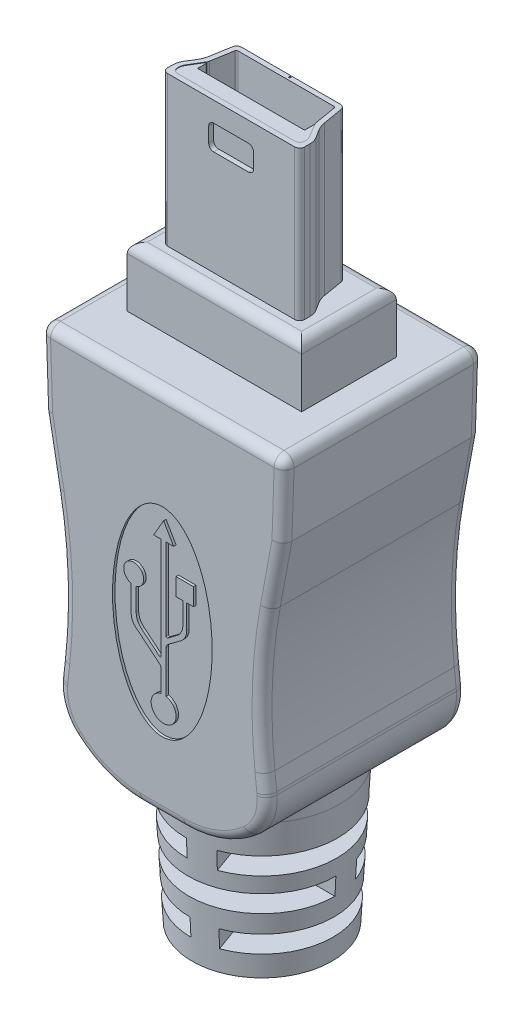
from build123d import *

# Parameters (mm, degrees)
BOSS_EXTRUDE1_DEPTH           = 10.16
FILLET1_R                     = 0.508
SKETCH2_RX                    = 5.08
SKETCH2_RY                    = 2.54
CUT_EXTRUDE1_DEPTH            = 0.127
BOSS_EXTRUDE2_DEPTH           = 0.127
SKETCH5_R                     = 3.937
BOSS_EXTRUDE3_DEPTH           = 7.112
BOSS_EXTRUDE3_TAPER           = 3
BOSS_EXTRUDE3_OTHER_WAY_DEPTH = 1.143
SKETCH6_W                     = 3.70295444
SKETCH6_H                     = 0.9144
SKETCH6_W_2                   = 4.181326544
SKETCH6_W_3                   = 3.560751893
SKETCH6_W_4                   = 3.266263681
CUT_REVOLVE1_ANGLE            = 160
SKETCH7_W                     = 3.335369985
SKETCH7_H                     = 0.9144
SKETCH7_W_2                   = 3.520668317
CUT_REVOLVE2_ANGLE            = 160
SKETCH8_W                     = 8.89
SKETCH8_H                     = 4.826
BOSS_EXTRUDE4_DEPTH           = 3.048
FILLET2_R                     = 0.508
BOSS_EXTRUDE5_DEPTH           = 7.62
CUT_EXTRUDE2_DEPTH            = 0.0254
CUT_EXTRUDE3_DEPTH            = 7.5946
FILLET3_R                     = 0.254
FILLET4_R                     = 0.0508
CUT_EXTRUDE4_DEPTH            = 0.254
SKETCH13_W                    = 0.2032
SKETCH13_H                    = 6.076805898
CUT_EXTRUDE5_DEPTH            = 0.127
FILLET5_R                     = 0.1016
CUT_EXTRUDE6_DEPTH            = 0.127


# Some blends are built 0.0001 mm under size
with BuildPart() as part:
    # Sketch1 → Boss-Extrude1 (new body)
    with BuildSketch(Plane.XY):
        with BuildLine():
            Line((-1.103751948, 0), (1.103751948, 0))
            ThreePointArc((1.103751948, 0), (2.928013381, 0.338853491), (4.508905778, 1.310208574))
            ThreePointArc((4.508905778, 1.310208574), (5.167779206, 2.25960855), (5.337834863, 3.402655173))
            ThreePointArc((5.337834863, 3.402655173), (5.331898585, 3.469616815), (5.325076735, 3.536494039))
            Line((5.325076735, 3.536494039), (5.228731209, 4.422872879))
            ThreePointArc((5.228731209, 4.422872879), (5.09778186, 8.117825142), (5.504637644, 11.792643279))
            Line((5.504637644, 11.792643279), (6.096, 14.986))
            Line((6.096, 14.986), (6.223, 18.796))
            Line((6.223, 18.796), (-6.223, 18.796))
            Line((-6.223, 18.796), (-6.096, 14.986))
            Line((-6.096, 14.986), (-5.504637644, 11.792643279))
            ThreePointArc((-5.504637644, 11.792643279), (-5.09778186, 8.117825142), (-5.228731209, 4.422872879))
            Line((-5.228731209, 4.422872879), (-5.325076735, 3.536494039))
            ThreePointArc((-5.325076735, 3.536494039), (-5.331898585, 3.469616815), (-5.337834863, 3.402655173))
            ThreePointArc((-5.337834863, 3.402655173), (-5.167779206, 2.25960855), (-4.508905778, 1.310208574))
            ThreePointArc((-4.508905778, 1.310208574), (-2.928013381, 0.338853491), (-1.103751948, 0))
        make_face()
    extrude(amount=BOSS_EXTRUDE1_DEPTH)

    # Fillet1
    fillet1_edges = [part.edges().sort_by_distance(p)[0] for p in [
        (0, 18.796, 10.16),
        (-6.1595, 16.891, 10.16),
        (5.09778186, 8.117825142, 0),
        (5.276903972, 3.979683459, 0),
        (5.331898585, 3.469616815, 0),
        (5.167779206, 2.25960855, 0),
        (2.928013381, 0.338853491, 0),
        (-5.800318822, 13.389321639, 10.16),
        (0, 0, 0),
        (-2.928013381, 0.338853491, 0),
        (-5.167779206, 2.25960855, 0),
        (-5.331898585, 3.469616815, 0),
        (-5.276903972, 3.979683459, 0),
        (-5.09778186, 8.117825142, 0),
        (-5.800318822, 13.389321639, 0),
        (-6.1595, 16.891, 0),
        (-5.09778186, 8.117825142, 10.16),
        (0, 18.796, 0),
        (6.1595, 16.891, 0),
        (5.800318822, 13.389321639, 0),
        (-5.276903972, 3.979683459, 10.16),
        (-5.331898585, 3.469616815, 10.16),
        (-6.223, 18.796, 5.08),
        (6.223, 18.796, 5.08),
        (-5.167779206, 2.25960855, 10.16),
        (-2.928013381, 0.338853491, 10.16),
        (0, 0, 10.16),
        (2.928013381, 0.338853491, 10.16),
        (5.800318822, 13.389321639, 10.16),
        (5.167779206, 2.25960855, 10.16),
        (5.331898585, 3.469616815, 10.16),
        (5.276903972, 3.979683459, 10.16),
        (5.09778186, 8.117825142, 10.16),
        (6.1595, 16.891, 10.16),
    ]]
    fillet(fillet1_edges, radius=FILLET1_R)

    # Sketch2 → Cut-Extrude1 (cut)
    with BuildSketch(Plane(origin=(0, 0, 0), x_dir=(-1, 0, 0), z_dir=(0, 0, -1))):
        with Locations(Location((0, 8.636), (0, 0, -90))):
            Ellipse(SKETCH2_RX, SKETCH2_RY)
    cut_extrude1 = extrude(amount=-CUT_EXTRUDE1_DEPTH, mode=Mode.SUBTRACT)

    # Mirror1: Cut-Extrude1 across plane
    add(cut_extrude1.mirror(Plane(origin=(0, 0, 5.08), x_dir=(1, 0, 0), z_dir=(0, 0, -1))), mode=Mode.SUBTRACT)

    # Sketch3 → Boss-Extrude2 (add)
    with BuildSketch(Plane.XY.offset(10.033)):
        with BuildLine():
            Line((0.063913268, 13.127552267), (-0.444086732, 12.247670457))
            Line((-0.444086732, 12.247670457), (-0.063086732, 12.247670457))
            Line((-0.063086732, 12.247670457), (-0.063086732, 7.08144457))
            ThreePointArc((-0.063086732, 7.08144457), (-0.092249225, 7.035483083), (-0.146254382, 7.042291342))
            Line((-0.146254382, 7.042291342), (-1.056601479, 7.794867762))
            ThreePointArc((-1.056601479, 7.794867762), (-1.26050904, 8.057603579), (-1.333086732, 8.382166179))
            Line((-1.333086732, 8.382166179), (-1.333086732, 9.534703008))
            ThreePointArc((-1.333086732, 9.534703008), (-1.460086732, 10.534571893), (-1.587086732, 9.534703008))
            Line((-1.587086732, 9.534703008), (-1.587086732, 8.190843329))
            ThreePointArc((-1.587086732, 8.190843329), (-1.529024578, 7.931193249), (-1.365898529, 7.721004596))
            Line((-1.365898529, 7.721004596), (-0.155248483, 6.72017021))
            ThreePointArc((-0.155248483, 6.72017021), (-0.087279296, 6.632591605), (-0.063086732, 6.524404071))
            Line((-0.063086732, 6.524404071), (-0.063086732, 5.433380207))
            ThreePointArc((-0.063086732, 5.433380207), (0.063913268, 4.176209812), (0.190913268, 5.433380207))
            Line((0.190913268, 5.433380207), (0.190913268, 7.580383413))
            ThreePointArc((0.190913268, 7.580383413), (0.21801678, 7.694549888), (0.293543062, 7.784351697))
            Line((0.293543062, 7.784351697), (0.931993655, 8.258162605))
            ThreePointArc((0.931993655, 8.258162605), (1.158572501, 8.527568033), (1.239883038, 8.870067456))
            Line((1.239883038, 8.870067456), (1.239883038, 10.090071893))
            Line((1.239883038, 10.090071893), (1.587913268, 10.090071893))
            Line((1.587913268, 10.090071893), (1.587913268, 10.979071893))
            Line((1.587913268, 10.979071893), (0.698913268, 10.979071893))
            Line((0.698913268, 10.979071893), (0.698913268, 10.090071893))
            Line((0.698913268, 10.090071893), (1.046943498, 10.090071893))
            Line((1.046943498, 10.090071893), (1.046943498, 9.010808617))
            ThreePointArc((1.046943498, 9.010808617), (0.965632961, 8.668309194), (0.739054116, 8.398903766))
            Line((0.739054116, 8.398903766), (0.271987309, 8.052281255))
            ThreePointArc((0.271987309, 8.052281255), (0.218879973, 8.047695615), (0.190913268, 8.093074912))
            Line((0.190913268, 8.093074912), (0.190913268, 12.247670457))
            Line((0.190913268, 12.247670457), (0.571913268, 12.247670457))
            Line((0.571913268, 12.247670457), (0.063913268, 13.127552267))
        make_face()
    extrude(amount=BOSS_EXTRUDE2_DEPTH)

    # Sketch5 → Boss-Extrude3 (add)
    with BuildSketch(Plane.XZ):
        with Locations((0, 5.08)):
            Circle(SKETCH5_R)
    extrude(amount=BOSS_EXTRUDE3_DEPTH, taper=BOSS_EXTRUDE3_TAPER)

    # Sketch5 → Boss-Extrude3 other way (add)
    with BuildSketch(Plane.XZ):
        with Locations((0, 5.08)):
            Circle(SKETCH5_R)
    extrude(amount=-BOSS_EXTRUDE3_OTHER_WAY_DEPTH)

    # Sketch6 → Cut-Revolve1 (revolve, cut)
    with BuildSketch(Plane(origin=(0, 0, 0), x_dir=(0, 0, -1), z_dir=(1, 0, 0))):
        with Locations((-9.21747722, -1.9812)):
            Rectangle(SKETCH6_W, SKETCH6_H)
        with Locations((-0.703336728, -1.9812)):
            Rectangle(SKETCH6_W_2, SKETCH6_H)
        with Locations((-1.013624054, -5.5626)):
            Rectangle(SKETCH6_W_3, SKETCH6_H)
        with Locations((-8.999131841, -5.5626)):
            Rectangle(SKETCH6_W_4, SKETCH6_H)
    revolve(axis=Axis((0, 0, 5.08), (0, -1, 0)), revolution_arc=CUT_REVOLVE1_ANGLE, mode=Mode.SUBTRACT)

    # Sketch7 → Cut-Revolve2 (revolve, cut)
    with BuildSketch(Plane(origin=(0, 0, 5.08), x_dir=(-1, 0, 0), z_dir=(0, 0, -1))):
        with Locations((-3.953684993, -3.7084)):
            Rectangle(SKETCH7_W, SKETCH7_H)
        with Locations((4.046334159, -3.7084)):
            Rectangle(SKETCH7_W_2, SKETCH7_H)
    revolve(axis=Axis((0, 0, 5.08), (0, -1, 0)), revolution_arc=CUT_REVOLVE2_ANGLE, mode=Mode.SUBTRACT)

    # Sketch8 → Boss-Extrude4 (add)
    with BuildSketch(Plane(origin=(0, 18.796, 0), x_dir=(1, 0, 0), z_dir=(0, 1, 0))):
        with Locations((0, -5.092622611)):
            Rectangle(SKETCH8_W, SKETCH8_H)
    extrude(amount=BOSS_EXTRUDE4_DEPTH)

    # Fillet2
    fillet2_edges = [part.edges().sort_by_distance(p)[0] for p in [
        (-4.445, 21.844, 5.092622611),
        (0, 21.844, 7.505622611),
        (4.445, 21.844, 5.092622611),
        (0, 21.844, 2.679622611),
    ]]
    fillet(fillet2_edges, radius=FILLET2_R)


with BuildPart() as body_2:
    # Sketch9 → Boss-Extrude5 (new body)
    with BuildSketch(Plane(origin=(0, 21.844, 0), x_dir=(1, 0, 0), z_dir=(0, 1, 0))):
        with BuildLine():
            Line((-2.516408614, -3.605760867), (2.516408614, -3.605760867))
            ThreePointArc((2.516408614, -3.605760867), (2.680195269, -3.665621917), (2.766781599, -3.81698975))
            Line((2.766781599, -3.81698975), (2.941675135, -4.840779148))
            ThreePointArc((2.941675135, -4.840779148), (3.008440818, -5.083475628), (3.121760525, -5.308237462))
            Line((3.121760525, -5.308237462), (3.364930012, -5.690769036))
            ThreePointArc((3.364930012, -5.690769036), (3.46010684, -5.901242733), (3.492697453, -6.12992517))
            Line((3.492697453, -6.12992517), (3.492697453, -6.399760867))
            ThreePointArc((3.492697453, -6.399760867), (3.418302576, -6.57936599), (3.238697453, -6.653760867))
            Line((3.238697453, -6.653760867), (0, -6.653760867))
            Line((0, -6.653760867), (-3.238697453, -6.653760867))
            ThreePointArc((-3.238697453, -6.653760867), (-3.418302576, -6.57936599), (-3.492697453, -6.399760867))
            Line((-3.492697453, -6.399760867), (-3.492697453, -6.12992517))
            ThreePointArc((-3.492697453, -6.12992517), (-3.46010684, -5.901242733), (-3.364930012, -5.690769036))
            Line((-3.364930012, -5.690769036), (-3.121760525, -5.308237462))
            ThreePointArc((-3.121760525, -5.308237462), (-3.008440818, -5.083475628), (-2.941675135, -4.840779148))
            Line((-2.941675135, -4.840779148), (-2.766781599, -3.81698975))
            ThreePointArc((-2.766781599, -3.81698975), (-2.680195269, -3.665621917), (-2.516408614, -3.605760867))
        make_face()
        with BuildLine():
            Line((-2.452121963, -3.859760867), (2.452121963, -3.859760867))
            ThreePointArc((2.452121963, -3.859760867), (2.501257959, -3.877719182), (2.527233858, -3.923129532))
            Line((2.527233858, -3.923129532), (2.727017896, -5.092622611))
            Line((2.727017896, -5.092622611), (2.727017896, -5.637760867))
            Line((2.727017896, -5.637760867), (-2.727017896, -5.637760867))
            Line((-2.727017896, -5.637760867), (-2.727017896, -5.092622611))
            Line((-2.727017896, -5.092622611), (-2.527233858, -3.923129532))
            ThreePointArc((-2.527233858, -3.923129532), (-2.501257959, -3.877719182), (-2.452121963, -3.859760867))
        make_face(mode=Mode.SUBTRACT)
    extrude(amount=BOSS_EXTRUDE5_DEPTH)

    # Sketch10 → Cut-Extrude2 (cut)
    with BuildSketch(Plane(origin=(0, 29.464, 0), x_dir=(1, 0, 0), z_dir=(0, 1, 0))):
        with BuildLine():
            Line((-2.727017896, -5.092622611), (-3.165950969, -5.82194639))
            ThreePointArc((-3.165950969, -5.82194639), (-3.220173084, -5.947965125), (-3.238697453, -6.083897487))
            Line((-3.238697453, -6.083897487), (-3.238697453, -6.145760867))
            ThreePointArc((-3.238697453, -6.145760867), (-3.164302576, -6.32536599), (-2.984697453, -6.399760867))
            Line((-2.984697453, -6.399760867), (2.984697453, -6.399760867))
            ThreePointArc((2.984697453, -6.399760867), (3.164302576, -6.32536599), (3.238697453, -6.145760867))
            Line((3.238697453, -6.145760867), (3.238697453, -6.083897487))
            ThreePointArc((3.238697453, -6.083897487), (3.220173084, -5.947965125), (3.165950969, -5.82194639))
            Line((3.165950969, -5.82194639), (2.727017896, -5.092622611))
            Line((2.727017896, -5.092622611), (-2.727017896, -5.092622611))
        make_face()
    extrude(amount=-CUT_EXTRUDE2_DEPTH, mode=Mode.SUBTRACT)

    # Sketch11 → Cut-Extrude3 (cut)
    with BuildSketch(Plane(origin=(0, 29.4386, 0), x_dir=(1, 0, 0), z_dir=(0, 1, 0))):
        Polygon((-2.764966878, -5.155677998), (-2.727017896, -5.155677998), (-2.727017896, -5.092622611), align=None)
        Polygon((2.727017896, -5.092622611), (2.764966878, -5.155677998), (2.727017896, -5.155677998), align=None)
    extrude(amount=-CUT_EXTRUDE3_DEPTH, mode=Mode.SUBTRACT)

    # Fillet3
    fillet3_edges = [body_2.edges().sort_by_distance(p)[0] for p in [
        (2.727017896, 25.654, 5.092622611),
        (-2.727017896, 25.654, 5.092622611),
    ]]
    fillet(fillet3_edges, radius=FILLET3_R)

    # Fillet4
    # the kernel refuses this fillet: 0.0508 mm, written as the material it takes off along each edge
    with BuildSketch(Plane(origin=(2.727017896, 29.561469121, 5.155677998), x_dir=(1.0, 0, 4.472607349155449e-11), z_dir=(0, -1, 0))) as fillet4_piece_1_section:
        with BuildLine():
            CenterArc((0.0508, 0.049147648), FILLET4_R, 179.999999997, 75.346503166)
            Line((0, 0.049147648), (-0.001016, 0.049147648))
            Line((-0.001016, 0.049147648), (-0.001016, 0))
            Line((-0.001016, 0), (0, -0.001016))
            ThreePointArc((0, -0.001016), (0.018974491, -0.001016), (0.037691962, -0.000982953))
            Line((0.037691962, -0.000982953), (0.037948982, 0))
        make_face()
    fillet4_piece_1 = extrude(amount=7.840338242, mode=Mode.PRIVATE)
    fillet4_piece_1 = split(fillet4_piece_1, bisect_by=Plane(origin=(2.762547757, 25.6413, 5.151658429), z_dir=(-0.856798259725176, 0, 0.5156517644029833)), keep=Keep.TOP, mode=Mode.PRIVATE)
    add(fillet4_piece_1, mode=Mode.SUBTRACT)
    with BuildSketch(Plane(origin=(-2.727017896, 29.561469121, 5.155677998), x_dir=(-1.0, 0, 4.465585987539768e-11), z_dir=(0, -1, 0))) as fillet4_piece_2_section:
        with BuildLine():
            CenterArc((0.0508, -0.049147648), FILLET4_R, 104.653496837, 75.346503166)
            Line((0, -0.049147648), (-0.001016, -0.049147648))
            Line((-0.001016, -0.049147648), (-0.001016, 0))
            Line((-0.001016, 0), (0, 0.001016))
            ThreePointArc((0, 0.001016), (0.018974491, 0.001016), (0.037691962, 0.000982953))
            Line((0.037691962, 0.000982953), (0.037948982, 0))
        make_face()
    fillet4_piece_2 = extrude(amount=7.840338242, mode=Mode.PRIVATE)
    fillet4_piece_2 = split(fillet4_piece_2, bisect_by=Plane(origin=(-2.762547757, 25.6413, 5.151658429), z_dir=(0.8567982597251798, 0, 0.5156517644029771)), keep=Keep.TOP, mode=Mode.PRIVATE)
    add(fillet4_piece_2, mode=Mode.SUBTRACT)

    # Sketch12 → Cut-Extrude4 (cut)
    with BuildSketch(Plane.XY.offset(6.653760867)):
        with BuildLine():
            Line((-0.889, 27.178), (0.889, 27.178))
            ThreePointArc((0.889, 27.178), (1.068605122, 27.252394878), (1.143, 27.432))
            Line((1.143, 27.432), (1.143, 28.194))
            ThreePointArc((1.143, 28.194), (1.068605122, 28.373605122), (0.889, 28.448))
            Line((0.889, 28.448), (-0.889, 28.448))
            ThreePointArc((-0.889, 28.448), (-1.068605122, 28.373605122), (-1.143, 28.194))
            Line((-1.143, 28.194), (-1.143, 27.432))
            ThreePointArc((-1.143, 27.432), (-1.068605122, 27.252394878), (-0.889, 27.178))
        make_face()
    extrude(amount=-CUT_EXTRUDE4_DEPTH, mode=Mode.SUBTRACT)

    # Sketch13 → Cut-Extrude5 (cut)
    with BuildSketch(Plane(origin=(0, 0, 5.637760867), x_dir=(-1, 0, 0), z_dir=(0, 0, -1))):
        Polygon((2.727017896, 21.844), (-2.727017896, 21.844), (-2.727017896, 29.17840689), (-1.711017896, 29.17840689), (-1.711017896, 27.971605898), (1.838017896, 27.971605898), (1.838017896, 29.17840689), (2.727017896, 29.17840689), align=None)
        Polygon((2.066617896, 27.946205898), (2.066617896, 29.15300689), (1.863417896, 29.15300689), (1.863417896, 27.946205898), (1.863417896, 21.8694), (2.066617896, 21.8694), align=None, mode=Mode.SUBTRACT)
        with Locations((1.014258948, 24.907802949)):
            Rectangle(SKETCH13_W, SKETCH13_H, mode=Mode.SUBTRACT)
        with Locations((0.0635, 24.907802949)):
            Rectangle(SKETCH13_W, SKETCH13_H, mode=Mode.SUBTRACT)
        with Locations((-0.887258948, 24.907802949)):
            Rectangle(SKETCH13_W, SKETCH13_H, mode=Mode.SUBTRACT)
        Polygon((-1.736417896, 21.8694), (-1.736417896, 27.946205898), (-1.736417896, 29.15300689), (-1.939617896, 29.15300689), (-1.939617896, 27.946205898), (-1.939617896, 21.8694), align=None, mode=Mode.SUBTRACT)
    extrude(amount=-CUT_EXTRUDE5_DEPTH, mode=Mode.SUBTRACT)

    # Fillet5
    fillet5_edges = [body_2.edges().sort_by_distance(p)[0] for p in [
        (0.785658948, 24.907802949, 5.637760867),
        (0.988858948, 24.907802949, 5.637760867),
        (1.736417896, 25.511203445, 5.637760867),
        (1.939617896, 25.511203445, 5.637760867),
        (0.0381, 24.907802949, 5.637760867),
        (-0.1651, 24.907802949, 5.637760867),
        (-0.912658948, 24.907802949, 5.637760867),
        (-1.115858948, 24.907802949, 5.637760867),
        (-2.066617896, 25.511203445, 5.637760867),
        (-1.863417896, 25.511203445, 5.637760867),
    ]]
    fillet(fillet5_edges, radius=FILLET5_R - 0.0001)  # a hair under: the kernel refuses the full size

    # Sketch14 → Cut-Extrude6 (cut)
    with BuildSketch(Plane(origin=(0, 0, 3.605760867), x_dir=(-1, 0, 0), z_dir=(0, 0, -1))):
        with BuildLine():
            Line((0, 21.844), (0, 24.725099071))
            ThreePointArc((0, 24.725099071), (0.054439168, 24.841844244), (0.178863982, 24.875183773))
            Line((0.178863982, 24.875183773), (0.52351469, 24.814412554))
            ThreePointArc((0.52351469, 24.814412554), (0.689414442, 24.858865258), (0.762, 25.014525489))
            Line((0.762, 25.014525489), (0.762, 26.816196829))
            ThreePointArc((0.762, 26.816196829), (0.689414442, 26.97185706), (0.52351469, 27.016309765))
            Line((0.52351469, 27.016309765), (0.178863982, 26.955538546))
            ThreePointArc((0.178863982, 26.955538546), (0.054439168, 26.988878074), (0, 27.105623248))
            Line((0, 27.105623248), (0, 29.464))
            Line((0, 29.464), (-0.0762, 29.464))
            Line((-0.0762, 29.464), (-0.0762, 27.075352706))
            ThreePointArc((-0.0762, 27.075352706), (-0.003614442, 26.919692475), (0.16228531, 26.875239771))
            Line((0.16228531, 26.875239771), (0.506936018, 26.93601099))
            ThreePointArc((0.506936018, 26.93601099), (0.631360832, 26.902671461), (0.6858, 26.785926288))
            Line((0.6858, 26.785926288), (0.6858, 25.044796031))
            ThreePointArc((0.6858, 25.044796031), (0.631360832, 24.928050857), (0.506936018, 24.894711329))
            Line((0.506936018, 24.894711329), (0.16228531, 24.955482548))
            ThreePointArc((0.16228531, 24.955482548), (-0.003614442, 24.911029843), (-0.0762, 24.755369612))
            Line((-0.0762, 24.755369612), (-0.0762, 21.844))
            Line((-0.0762, 21.844), (0, 21.844))
        make_face()
    extrude(amount=-CUT_EXTRUDE6_DEPTH, mode=Mode.SUBTRACT)


solid = Compound([part.part, body_2.part])
